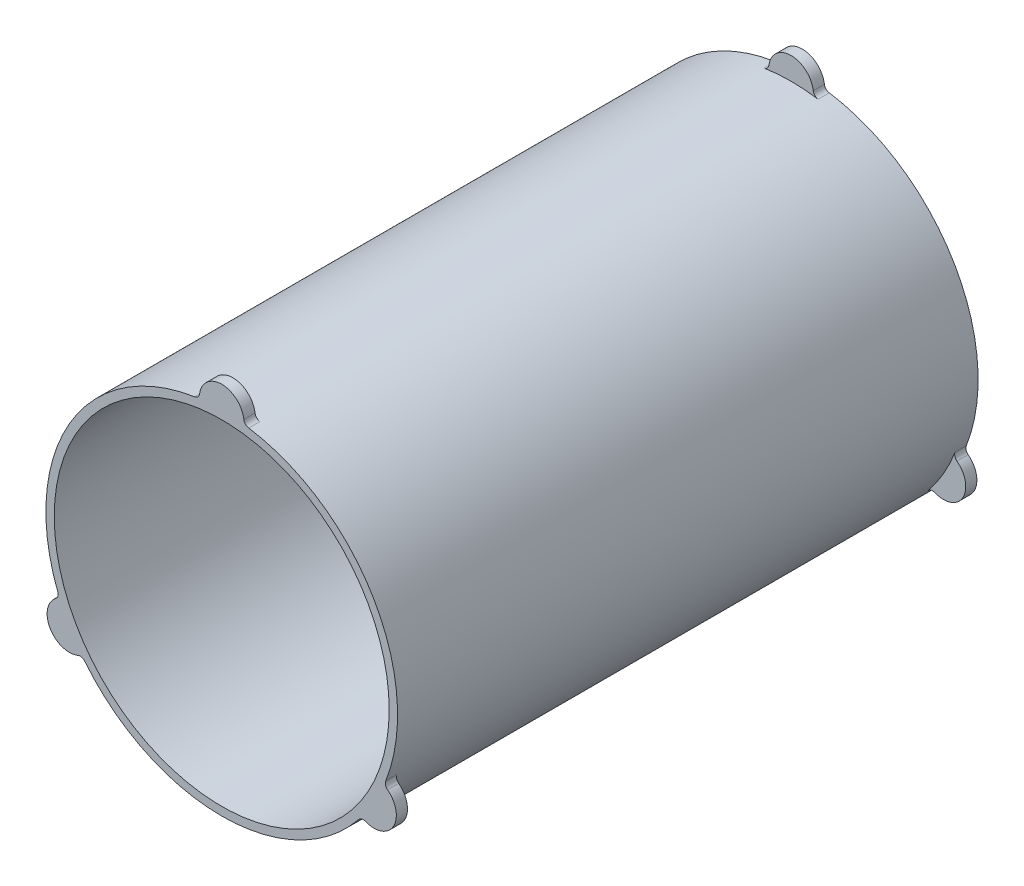
from build123d import *

# Parameters (mm, degrees)
SKETCH1_R                = 100.0125
SKETCH1_R_2              = 95.25
EXTRUDE_THIN1_DEPTH      = 165.1
BOSS_EXTRUDE1_DEPTH      = 6.35
FILLET1_R                = 3.302
CIRPATTERN1_COUNT        = 3
FILLET1_OF_CIRPATTERN1_R = 3.302
MIRROR2_START            = -165.1
MIRROR2_DEPTH            = 6.35


# Read off the part's stored shape, not the designer's step: Mirror2
with BuildPart() as part:
    # Sketch1 → Extrude-Thin1 (new, symmetric)
    with BuildSketch(Plane.XY):
        Circle(SKETCH1_R)
        Circle(SKETCH1_R_2, mode=Mode.SUBTRACT)
    extrude(amount=EXTRUDE_THIN1_DEPTH, both=True)

    # Sketch2 → Boss-Extrude1 (add)
    with BuildSketch(Plane.XY.offset(165.1)):
        with BuildLine():
            ThreePointArc((-12.674375762, 99.206150794), (0, 112.7125), (12.674375762, 99.206150794))
            ThreePointArc((12.674375762, 99.206150794), (0, 100.0125), (-12.674375762, 99.206150794))
        make_face()
    boss_extrude1 = extrude(amount=-BOSS_EXTRUDE1_DEPTH)

    # Fillet1
    fillet1_edges = [part.edges().sort_by_distance(p)[0] for p in [
        (12.674375762, 99.206150794, 161.925),
        (-12.674375762, 99.206150794, 161.925),
    ]]
    fillet(fillet1_edges, radius=FILLET1_R)

    # CirPattern1: Boss-Extrude1 ×3 about axis
    cirpattern1_axis = Axis((0, 0, 0), (0, 0, 1))
    for i in range(1, CIRPATTERN1_COUNT):
        add(boss_extrude1.rotate(cirpattern1_axis, i * 360 / CIRPATTERN1_COUNT))

    # Fillet1 of CirPattern1
    fillet1_of_cirpattern1_edges = [part.edges().sort_by_distance(p)[0] for p in [
        (-92.25223468, -38.62674401, 161.925),
        (-79.577858918, -60.579406784, 161.925),
        (79.577858918, -60.579406784, 161.925),
        (92.25223468, -38.62674401, 161.925),
    ]]
    fillet(fillet1_of_cirpattern1_edges, radius=FILLET1_OF_CIRPATTERN1_R)

    # Mirror2 outline → Mirror2 (add)
    with BuildSketch(Plane.XY.offset(MIRROR2_START)):
        with BuildLine():
            ThreePointArc((12.592634281, 101.660396196), (0, 112.7125), (-12.592634281, 101.660396196))
            ThreePointArc((-12.592634281, 101.660396196), (-13.503928486, 99.78224476), (-15.359608316, 98.826021819))
            ThreePointArc((-15.359608316, 98.826021819), (0, 100.0125), (15.359608316, 98.826021819))
            ThreePointArc((15.359608316, 98.826021819), (13.503928486, 99.78224476), (12.592634281, 101.660396196))
        make_face()
        with BuildLine():
            ThreePointArc((-77.906041293, -62.714821903), (-86.613365696, -50.00625), (-93.265649608, -36.111199916))
            ThreePointArc((-93.265649608, -36.111199916), (-93.165923052, -38.19637726), (-94.336802804, -39.92465691))
            ThreePointArc((-94.336802804, -39.92465691), (-97.611888324, -56.35625), (-81.744168524, -61.735739285))
            ThreePointArc((-81.744168524, -61.735739285), (-79.661994566, -61.5858675), (-77.906041293, -62.714821903))
        make_face()
        with BuildLine():
            ThreePointArc((94.336802804, -39.92465691), (93.165923052, -38.19637726), (93.265649608, -36.111199916))
            ThreePointArc((93.265649608, -36.111199916), (86.613365696, -50.00625), (77.906041293, -62.714821903))
            ThreePointArc((77.906041293, -62.714821903), (79.661994566, -61.5858675), (81.744168524, -61.735739285))
            ThreePointArc((81.744168524, -61.735739285), (97.611888324, -56.35625), (94.336802804, -39.92465691))
        make_face()
    extrude(amount=MIRROR2_DEPTH)


solid = part.part
